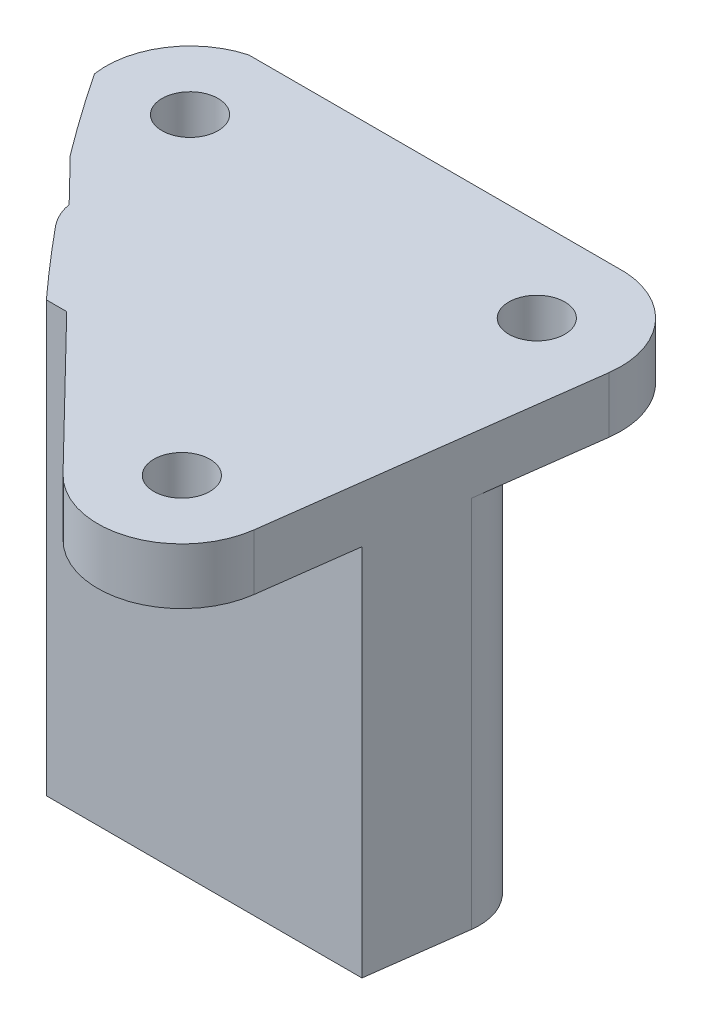
from build123d import *

# Parameters (mm, degrees)
EXTRUDE_1_OUTLINE_R = 1.5
EXTRUDE_1_DEPTH     = 3
EXTRUDE_2_DEPTH     = 25
EXTRUDE_3_DEPTH     = 3
EXTRUDE_4_REACH     = 147.278
FILLET_1_R          = 3
SKETCH_5_R          = 1.5
CUT_EXTRUDE_3_DEPTH = 15
SKETCH_6_R          = 126.976740186
SKETCH_6_R_2        = 100
CUT_EXTRUDE_4_DEPTH = 30
SKETCH_8_W          = 28.33895888
SKETCH_8_H          = 14.242713356
CUT_EXTRUDE_5_DEPTH = 5


# Read off the part's stored shape, not the designer's step: 填料-伸長1
with BuildPart() as part:
    # 填料-伸長1 outline → 填料-伸長1 (new body)
    with BuildSketch(Plane.XZ.offset(-131.641882403)):
        with BuildLine():
            ThreePointArc((-105.458191259, 52.468420543), (-108.501205852, 56.151510861), (-113.143070085, 55.020940854))
            Line((-113.143070085, 55.020940854), (-129.654103506, 38.071506203))
            ThreePointArc((-129.654103506, 38.071506203), (-130.77342938, 33.752171981), (-127.62304878, 30.592323786))
            Line((-127.62304878, 30.592323786), (-107.96955265, 30.592323786))
            ThreePointArc((-107.96955265, 30.592323786), (-104.412306977, 32.020558846), (-103.246421534, 35.67221098))
            Line((-103.246421534, 35.67221098), (-105.458191259, 52.468420543))
        make_face()
        with Locations((-126.430709133, 34.931485706)):
            Circle(EXTRUDE_1_OUTLINE_R, mode=Mode.SUBTRACT)
        with Locations((-107.707905988, 35.084710794)):
            Circle(EXTRUDE_1_OUTLINE_R, mode=Mode.SUBTRACT)
        with Locations((-109.919675712, 51.880920357)):
            Circle(EXTRUDE_1_OUTLINE_R, mode=Mode.SUBTRACT)
    extrude(amount=EXTRUDE_1_DEPTH)

    # 草圖2 → 填料-伸長2 (add)
    with BuildSketch(Plane.XZ.offset(-128.641882403)):
        Polygon((-104.786745972, 47.369455849), (-124.786745972, 47.369455849), (-124.786745972, 44.369455849), (-104.786745972, 44.369455849), (-104.391697962, 44.369455849), align=None)
    extrude(amount=EXTRUDE_2_DEPTH)

    # 草圖3 → 填料-伸長3 (add)
    with BuildSketch(Plane(origin=(0, 128.641882403, 0), x_dir=(1, 0, 0), z_dir=(0, 1, 0))):
        Polygon((-124.786745972, -47.369455849), (-120.596647578, -47.369455849), (-123.519051852, -44.369455849), (-124.786745972, -44.369455849), align=None)
    extrude(amount=EXTRUDE_3_DEPTH)

    # 填料-伸長4: up to this face of the body (flat: up to its plane)
    extrude_4_end = Plane(part.part.faces().sort_by_distance((-115.187288505, 131.641882403, 40.896845269))[0])
    # 草圖4 → 填料-伸長4 (add, up to the picked face)
    with BuildSketch(Plane.XZ.offset(-103.641882403), mode=Mode.PRIVATE) as extrude_4_sk1:
        with BuildLine():
            Line((-104.786745972, 47.369455849), (-103.657869092, 38.796749367))
            Line((-103.657869092, 38.796749367), (-128.657869092, 38.796749367))
            ThreePointArc((-128.657869092, 38.796749367), (-125.290449125, 43.179472861), (-121.686031693, 47.369455849))
            Line((-121.686031693, 47.369455849), (-104.786745972, 47.369455849))
        make_face()
    extrude_4_tool1 = split(extrude(extrude_4_sk1.sketch, amount=-EXTRUDE_4_REACH, mode=Mode.PRIVATE), bisect_by=extrude_4_end, keep=Keep.BOTH, mode=Mode.PRIVATE)
    add(extrude_4_tool1.solids().sort_by(Axis((-114.856202, 103.641882, 42.808825), (0, 1, 0)))[0])

    # 圓角1
    # the kernel refuses this fillet: 3 mm, written as the material it takes off along each edge
    with BuildSketch(Plane(origin=(-128.657869092, 88.125757689, 38.796749367), x_dir=(1, 0, 0), z_dir=(0, 1, 0))) as fillet_1_piece_1:
        with BuildLine():
            CenterArc((6.112644238, -3), FILLET_1_R, 90, 129.509532044)
            ThreePointArc((3.798087984, -4.90861975), (1.860953441, -2.483782776), (0, 0))
            Line((0, 0), (6.112644238, 0))
        make_face()
    extrude(amount=40.516124714, mode=Mode.SUBTRACT)
    with BuildSketch(Plane(origin=(-128.657869092, 88.125757689, 38.796749367), x_dir=(1, 0, 0), z_dir=(0, 1, 0))) as fillet_1_piece_2_section:
        with BuildLine():
            CenterArc((6.112644238, -3), FILLET_1_R, 90, 129.509532044)
            ThreePointArc((3.798087984, -4.90861975), (1.860953441, -2.483782776), (0, 0))
            Line((0, 0), (6.112644238, 0))
        make_face()
    fillet_1_piece_2 = extrude(amount=56.032249428, mode=Mode.PRIVATE)
    fillet_1_piece_2 = split(fillet_1_piece_2, bisect_by=Plane(origin=(-126.052723455, 130.141882403, 41.768510156), z_dir=(-0.7163098605374205, 0, 0.6977823326058501)), keep=Keep.TOP, mode=Mode.PRIVATE)
    add(fillet_1_piece_2, mode=Mode.SUBTRACT)
    with BuildSketch(Plane(origin=(-103.657869092, 95.089515631, 38.796749367), x_dir=(-0.13055559688671156, 0, 0.9914409897323968), z_dir=(0, 1, 0))) as fillet_1_piece_3:
        with BuildLine():
            CenterArc((FILLET_1_R * 1.14031556955, -FILLET_1_R), FILLET_1_R, 90, 97.501699304)
            Line((FILLET_1_R * 0.148874579822, -FILLET_1_R * 1.13055559689), (0, 0))
            Line((0, 0), (FILLET_1_R * 1.14031556955, 0))
        make_face()
    extrude(amount=33.552366772, mode=Mode.SUBTRACT)

    # 草圖5 → 除料-伸長3 (cut)
    with BuildSketch(Plane.XZ.offset(-103.641882403)):
        with Locations(Location((-106.94667544, 41.72393279, 0), (0, 0, 270))):
            Circle(SKETCH_5_R)
        with Locations(Location((-122.44667544, 41.72393279, 0), (0, 0, 270))):
            Circle(SKETCH_5_R)
    extrude(amount=-CUT_EXTRUDE_3_DEPTH, mode=Mode.SUBTRACT)

    # 草圖6 → 除料-伸長4 (cut)
    with BuildSketch(Plane.XZ.offset(-103.641882403)):
        with Locations((-47.707905988, -19.915289206)):
            Circle(SKETCH_6_R)
        with Locations((-47.707905988, -19.915289206)):
            Circle(SKETCH_6_R_2, mode=Mode.SUBTRACT)
    extrude(amount=-CUT_EXTRUDE_4_DEPTH, mode=Mode.SUBTRACT)

    # 草圖8 → 除料-伸長5 (cut)
    with BuildSketch(Plane.XZ.offset(-103.641882403)):
        with Locations((-114.972608674, 43.454782353)):
            Rectangle(SKETCH_8_W, SKETCH_8_H)
    extrude(amount=-CUT_EXTRUDE_5_DEPTH, mode=Mode.SUBTRACT)


solid = part.part
